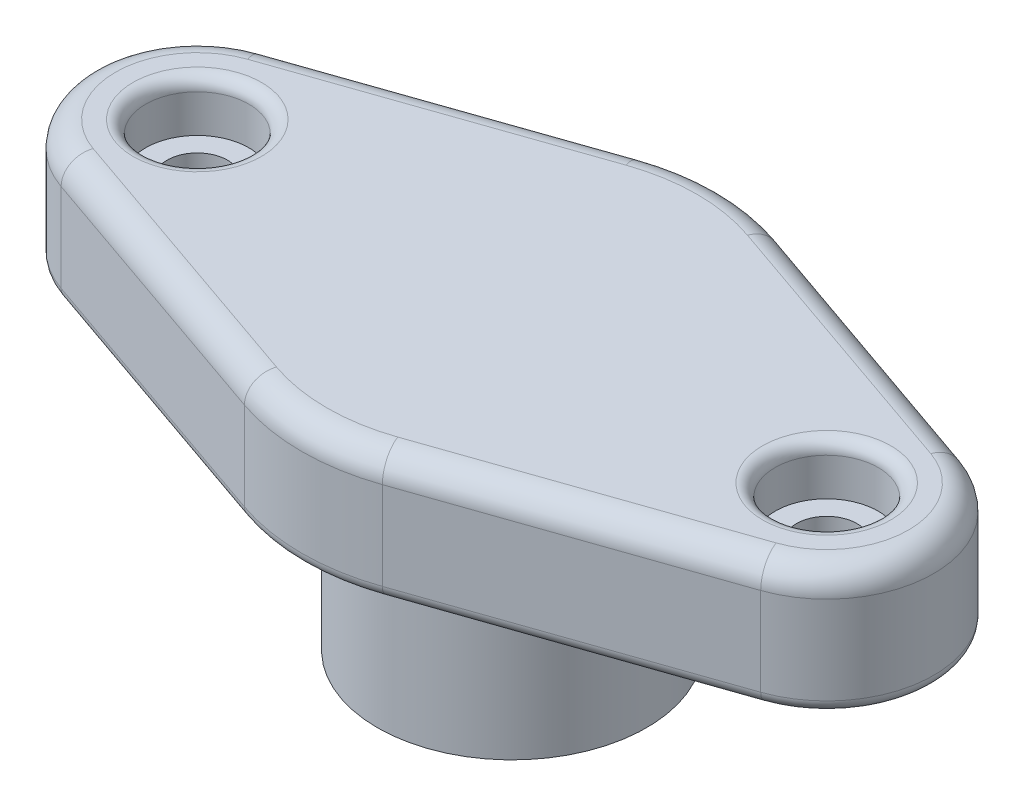
from build123d import *

# Parameters (mm, degrees)
SKETCH1_R           = 5.35
BOSS_EXTRUDE1_DEPTH = 7
SKETCH2_R           = 1.2
BOSS_EXTRUDE2_DEPTH = 5
SKETCH3_R           = 2.05
CUT_EXTRUDE1_DEPTH  = 2
FILLET1_R           = 0.5
FILLET2_R           = 1
SKETCH4_R           = 3.5
CUT_EXTRUDE2_DEPTH  = 2
FILLET3_R           = 1


with BuildPart() as part:
    # Sketch1 → Boss-Extrude1 (new body)
    with BuildSketch(Plane(origin=(0, 0, 0), x_dir=(1, 0, 0), z_dir=(0, 1, 0))):
        with Locations(Location((0, 0, 0), (0, 0, 270))):
            Circle(SKETCH1_R)
    extrude(amount=BOSS_EXTRUDE1_DEPTH)

    # Sketch2 → Boss-Extrude2 (add)
    with BuildSketch(Plane(origin=(0, 7, 0), x_dir=(1, 0, 0), z_dir=(0, 1, 0))):
        with BuildLine():
            Line((2.7388, 7.888058986), (13.894, 4.014880322))
            ThreePointArc((13.894, 4.014880322), (16.75, 0), (13.894, -4.014880322))
            Line((13.894, -4.014880322), (2.7388, -7.888058986))
            ThreePointArc((2.7388, -7.888058986), (0, -8.35), (-2.7388, -7.888058986))
            Line((-2.7388, -7.888058986), (-13.894, -4.014880322))
            ThreePointArc((-13.894, -4.014880322), (-16.75, 0), (-13.894, 4.014880322))
            Line((-13.894, 4.014880322), (-2.7388, 7.888058986))
            ThreePointArc((-2.7388, 7.888058986), (0, 8.35), (2.7388, 7.888058986))
        make_face()
        with Locations(Location((12.5, 0, 0), (0, 0, 270))):
            Circle(SKETCH2_R, mode=Mode.SUBTRACT)
        with Locations(Location((-12.5, 0, 0), (0, 0, 270))):
            Circle(SKETCH2_R, mode=Mode.SUBTRACT)
    extrude(amount=BOSS_EXTRUDE2_DEPTH)

    # Sketch3 → Cut-Extrude1 (cut)
    with BuildSketch(Plane(origin=(0, 12, 0), x_dir=(1, 0, 0), z_dir=(0, 1, 0))):
        with Locations(Location((-12.5, 0, 0), (0, 0, 270))):
            Circle(SKETCH3_R)
        with Locations(Location((12.5, 0, 0), (0, 0, 270))):
            Circle(SKETCH3_R)
    extrude(amount=-CUT_EXTRUDE1_DEPTH, mode=Mode.SUBTRACT)

    # Fillet1
    fillet1_edges = [part.edges().sort_by_distance(p)[0] for p in [
        (-8.3164, 7, 5.951469654),
        (0, 7, 8.35),
        (8.3164, 7, 5.951469654),
        (16.75, 7, 0),
        (8.3164, 7, -5.951469654),
        (-12.5, 12, -2.05),
        (12.5, 12, -2.05),
        (0, 7, -8.35),
        (-8.3164, 7, -5.951469654),
        (-16.75, 7, 0),
    ]]
    fillet(fillet1_edges, radius=FILLET1_R)

    # Fillet2
    fillet2_edges = [part.edges().sort_by_distance(p)[0] for p in [
        (0, 12, -8.35),
        (-8.3164, 12, -5.951469654),
        (-16.75, 12, 0),
        (-8.3164, 12, 5.951469654),
        (0, 12, 8.35),
        (8.3164, 12, 5.951469654),
        (16.75, 12, 0),
        (8.3164, 12, -5.951469654),
    ]]
    fillet(fillet2_edges, radius=FILLET2_R)

    # Sketch4 → Cut-Extrude2 (cut)
    with BuildSketch(Plane.XZ):
        with Locations(Location((0, 0, 0), (0, 0, 270))):
            Circle(SKETCH4_R)
    extrude(amount=-CUT_EXTRUDE2_DEPTH, mode=Mode.SUBTRACT)

    # Fillet3
    fillet3_edges = [part.edges().sort_by_distance(p)[0] for p in [
        (0, 2, 3.5),
        (0, 0, 3.5),
    ]]
    fillet(fillet3_edges, radius=FILLET3_R - 0.0001)  # a hair under: the kernel refuses the full size


solid = part.part
